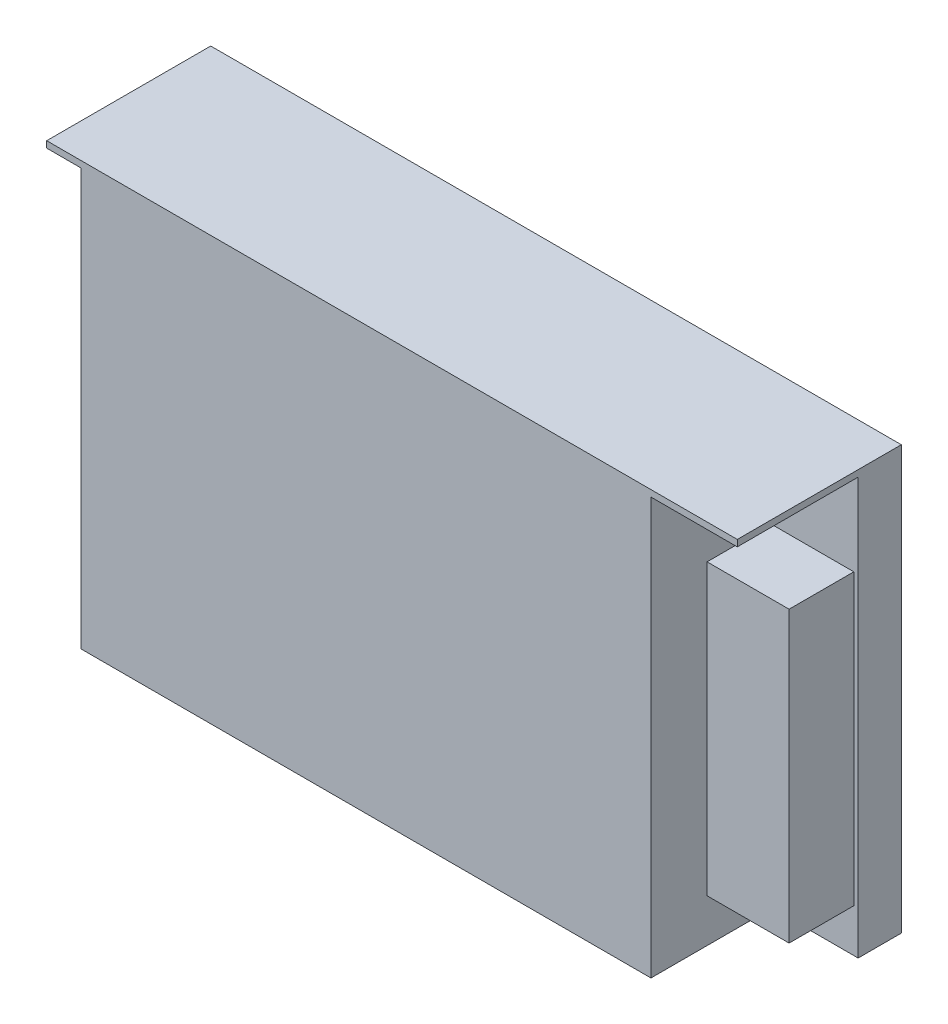
from build123d import *

# Parameters (mm, degrees)
SKETCH_1_W          = 160
SKETCH_1_H          = 98
EXTRUDE_1_DEPTH     = 38
SKETCH_2_W          = 20
SKETCH_2_H          = 96.5
CUT_EXTRUDE_1_DEPTH = 28
SKETCH_3_W          = 19
SKETCH_3_H          = 67
EXTRUDE_2_DEPTH     = 15
SKETCH_4_W          = 16
SKETCH_4_H          = 96.5
CUT_EXTRUDE_2_DEPTH = 8
CHAMFER_1_SIZE      = 8
CUT_EXTRUDE_3_DEPTH = 10


with BuildPart() as part:
    # 草图1 → 凸台-拉伸1 (new body)
    with BuildSketch(Plane.XY):
        with Locations((80, 49)):
            Rectangle(SKETCH_1_W, SKETCH_1_H)
    extrude(amount=EXTRUDE_1_DEPTH)

    # 草图2 → 切除-拉伸1 (cut)
    with BuildSketch(Plane.XY.offset(38)):
        with Locations((150, 48.25)):
            Rectangle(SKETCH_2_W, SKETCH_2_H)
    extrude(amount=-CUT_EXTRUDE_1_DEPTH, mode=Mode.SUBTRACT)

    # 草图3 → 凸台-拉伸2 (add)
    with BuildSketch(Plane.XY.offset(10)):
        with Locations((149.5, 43.5)):
            Rectangle(SKETCH_3_W, SKETCH_3_H)
    extrude(amount=EXTRUDE_2_DEPTH)

    # 草图4 → 切除-拉伸2 (cut)
    with BuildSketch(Plane.ZY):
        with Locations((30, 48.25)):
            Rectangle(SKETCH_4_W, SKETCH_4_H)
    extrude(amount=-CUT_EXTRUDE_2_DEPTH, mode=Mode.SUBTRACT)

    # 倒角1
    chamfer_1_edges = [part.edges().sort_by_distance(p)[0] for p in [
        (8, 48.25, 22),
    ]]
    chamfer(chamfer_1_edges, length=CHAMFER_1_SIZE - 0.0001)  # a hair under: the kernel refuses the full size

    # 草图5 → 切除-拉伸3 (cut)
    with BuildSketch(Plane.XZ):
        Polygon((0, 22), (8, 30), (8, 1.5), (0, 1.5), align=None)
    extrude(amount=-CUT_EXTRUDE_3_DEPTH, mode=Mode.SUBTRACT)


solid = part.part
